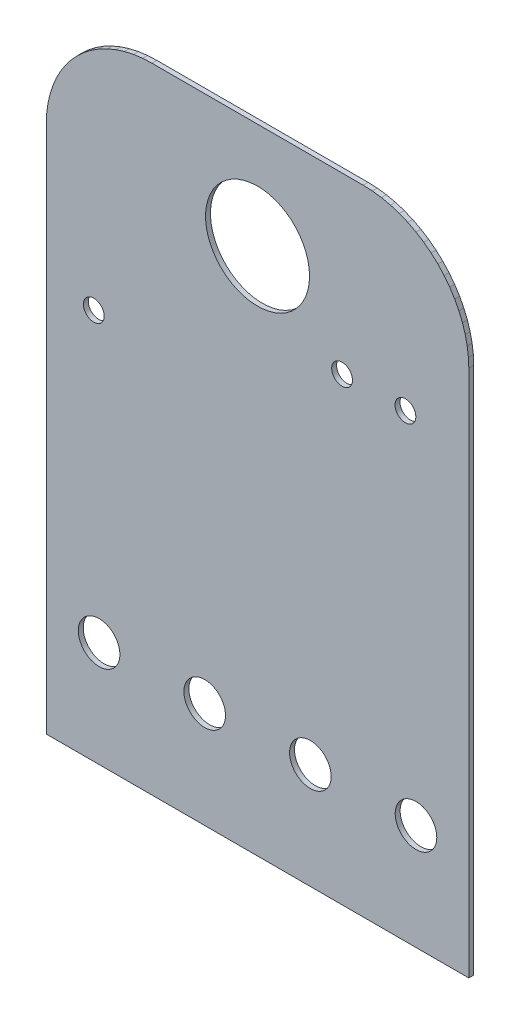
from build123d import *

# Parameters (mm, degrees)
MODEL_R             = 31.75
MODEL_R_2           = 12.7
MODEL_R_3           = 6.35
BOSS_EXTRUDE1_DEPTH = 3


with BuildPart() as part:
    # Model → Boss-Extrude1 (new body)
    with BuildSketch(Plane.XY):
        Polygon((0, 0), (258.064, 0), (258.064, 322.58), (257.818493125, 328.202925), (257.0838775, 333.783066875), (255.865709375, 339.27796), (254.17319625, 344.64577375), (252.019355625, 349.84563), (249.420459375, 354.838), (246.396430625, 359.584863125), (242.970129375, 364.05010375), (239.16767, 368.19967), (235.01810375, 372.002129375), (230.552863125, 375.428430625), (225.806, 378.452459375), (220.81363, 381.051355625), (215.61377375, 383.20519625), (210.24596, 384.897709375), (204.751066875, 386.1158775), (199.170925, 386.850493125), (193.548, 387.096), (64.516, 387.096), (58.893075, 386.850493125), (53.312933125, 386.1158775), (47.81804, 384.897709375), (42.45022625, 383.20519625), (37.25037, 381.051355625), (32.258, 378.452459375), (27.511136875, 375.428430625), (23.04589625, 372.002129375), (18.89633, 368.19967), (15.093870625, 364.05010375), (11.667569375, 359.584863125), (8.643540625, 354.838), (6.044644375, 349.84563), (3.89080375, 344.64577375), (2.198290625, 339.27796), (0.9801225, 333.783066875), (0.245506875, 328.202925), (0, 322.58), align=None)
        with Locations((129.032, 322.58)):
            Circle(MODEL_R, mode=Mode.SUBTRACT)
        with Locations((225.806, 64.516)):
            Circle(MODEL_R_2, mode=Mode.SUBTRACT)
        with Locations((161.29, 64.516)):
            Circle(MODEL_R_2, mode=Mode.SUBTRACT)
        with Locations((96.774, 64.516)):
            Circle(MODEL_R_2, mode=Mode.SUBTRACT)
        with Locations((32.258, 64.516)):
            Circle(MODEL_R_2, mode=Mode.SUBTRACT)
        with Locations((29.0322, 238.7092)):
            Circle(MODEL_R_3, mode=Mode.SUBTRACT)
        with Locations((219.3544, 280.6446)):
            Circle(MODEL_R_3, mode=Mode.SUBTRACT)
        with Locations((180.6448, 280.6446)):
            Circle(MODEL_R_3, mode=Mode.SUBTRACT)
    extrude(amount=BOSS_EXTRUDE1_DEPTH)


solid = part.part
